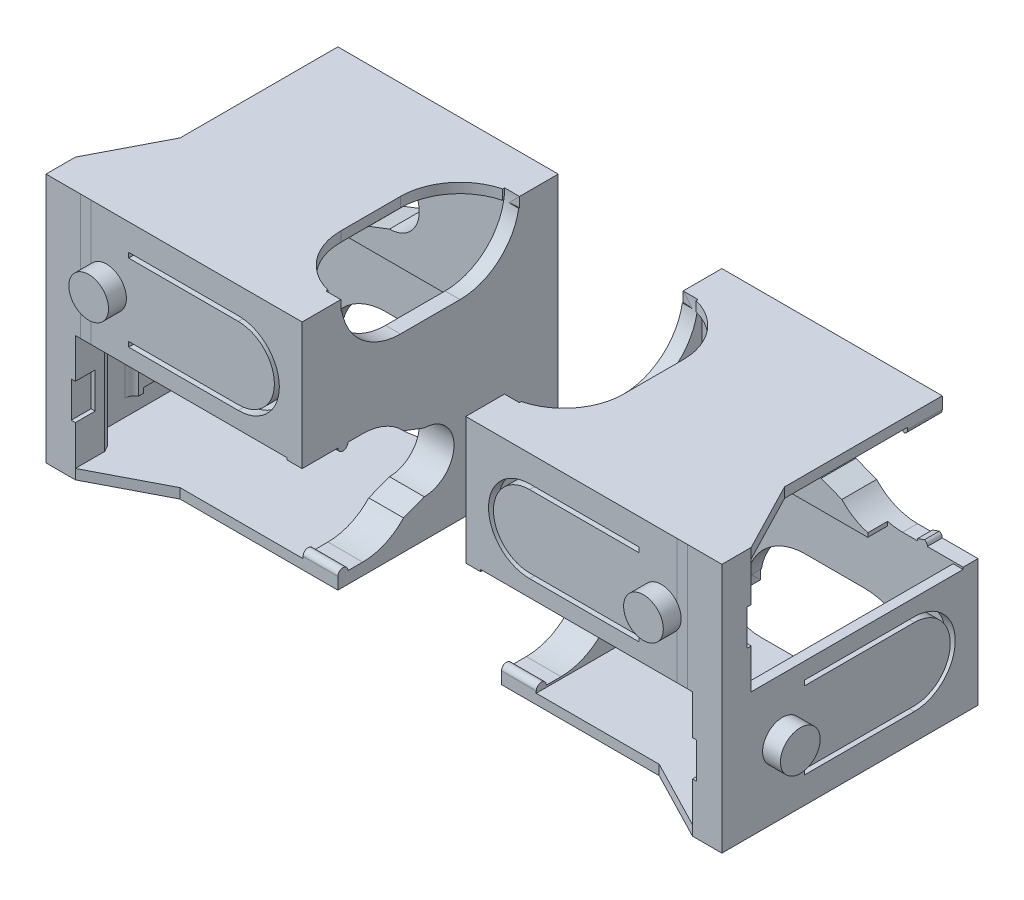
from build123d import *

# Parameters (mm, degrees)
EXTRUDE_1_DEPTH      = 3.5
SKETCH_2_W           = 25.8
SKETCH_2_H           = 12.6
EXTRUDE_2_DEPTH      = 1.5
EXTRUDE_3_DEPTH      = 3.5
SKETCH_4_W           = 24.05
SKETCH_4_H           = 12.4
EXTRUDE_4_DEPTH      = 1.5
EXTRUDE_5_DEPTH      = 18.6
EXTRUDE_6_DEPTH      = 25
EXTRUDE_7_REACH      = 49.494
SKETCH_7_W           = 1.5
SKETCH_7_H           = 12.6
EXTRUDE_8_REACH      = 44.256
SKETCH_9_R           = 2
EXTRUDE_9_DEPTH      = 1.8
SKETCH_10_R          = 2
EXTRUDE_10_DEPTH     = 1.8
SKETCH_11_W          = 2
SKETCH_11_H          = 3.6
CUT_EXTRUDE_1_DEPTH  = 2
SKETCH_12_W          = 2
SKETCH_12_H          = 3.6
CUT_EXTRUDE_2_DEPTH  = 2
EXTRUDE_11_DEPTH     = 24.3
EXTRUDE_12_DEPTH     = 20.8
CUT_EXTRUDE_START    = -12.4
CUT_EXTRUDE_3_DEPTH  = 12.4
CUT_EXTRUDE_START_2  = -12.6
CUT_EXTRUDE_4_DEPTH  = 12.6
EXTRUDE_START        = -12.6
EXTRUDE_15_DEPTH     = 12.6
EXTRUDE_START_2      = -12.4
EXTRUDE_16_DEPTH     = 12.4
EXTRUDE_START_3      = -0.8
EXTRUDE_17_DEPTH     = 0.8
EXTRUDE_START_4      = -1
EXTRUDE_18_DEPTH     = 1
CUT_EXTRUDE_5_DEPTH  = 4
SKETCH_25_W          = 1.5
SKETCH_25_H          = 0.2
EXTRUDE_21_DEPTH     = 3.6
EXTRUDE_22_DEPTH     = 0.2
CUT_EXTRUDE_6_DEPTH  = 4
SKETCH_29_W          = 1.5
SKETCH_29_H          = 0.2
EXTRUDE_24_DEPTH     = 3.6
CUT_EXTRUDE_7_DEPTH  = 1.5
CUT_EXTRUDE_8_DEPTH  = 1
CUT_EXTRUDE_9_DEPTH  = 1.5
CUT_EXTRUDE_10_DEPTH = 1
CUT_EXTRUDE_START_3  = -1.5
CUT_EXTRUDE_11_DEPTH = 1.5
SKETCH_35_W          = 20.566820387
SKETCH_35_H          = 11.6
CUT_EXTRUDE_12_DEPTH = 0.5
FILLET_2_R           = 1
CUT_EXTRUDE_13_DEPTH = 1.5
SKETCH_38_W          = 20.566820387
SKETCH_38_H          = 11.6
CUT_EXTRUDE_14_DEPTH = 0.5
FILLET_3_R           = 1


with BuildPart() as part:
    # ｽｹｯﾁ1 → ﾎﾞｽ - 押し出し1 (new body)
    with BuildSketch(Plane(origin=(0, 0, -3.388895834), x_dir=(-1, 0, 0), z_dir=(0, 0, -1))):
        with BuildLine():
            Line((-21.742324867, 16.721375858), (-23.828932106, 15.921375858))
            ThreePointArc((-23.828932106, 15.921375858), (-25.697330435, 14.591073722), (-27.942324867, 14.121375858))
            Line((-27.942324867, 14.121375858), (-29.421312595, 14.121375858))
            ThreePointArc((-29.421312595, 14.121375858), (-29.432926589, 14.229649335), (-29.467240137, 14.332996378))
            ThreePointArc((-29.467240137, 14.332996378), (-29.817026044, 14.444492735), (-30.158754705, 14.578668519))
            ThreePointArc((-30.158754705, 14.578668519), (-30.365678571, 14.390415174), (-30.442324867, 14.121375858))
            Line((-30.442324867, 14.121375858), (-30.442324867, 13.921375858))
            Line((-30.442324867, 13.921375858), (-27.942324867, 13.921375858))
            Line((-27.942324867, 13.921375858), (-9.742324867, 13.921375858))
            Line((-9.742324867, 13.921375858), (-8.242324867, 13.921375858))
            Line((-8.242324867, 13.921375858), (-8.242324867, 25.521375858))
            Line((-8.242324867, 25.521375858), (-8.242324867, 26.321375858))
            Line((-8.242324867, 26.321375858), (-27.942324867, 26.321375858))
            Line((-27.942324867, 26.321375858), (-30.442324867, 26.321375858))
            Line((-30.442324867, 26.321375858), (-30.442324867, 25.321375858))
            ThreePointArc((-30.442324867, 25.321375858), (-30.365678571, 25.052336541), (-30.158754705, 24.864083196))
            ThreePointArc((-30.158754705, 24.864083196), (-29.817026044, 24.998258981), (-29.467240137, 25.109755337))
            ThreePointArc((-29.467240137, 25.109755337), (-29.432926589, 25.21310238), (-29.421312595, 25.321375858))
            Line((-29.421312595, 25.321375858), (-27.942324867, 25.321375858))
            ThreePointArc((-27.942324867, 25.321375858), (-25.697330435, 24.851677993), (-23.828932106, 23.521375858))
            Line((-23.828932106, 23.521375858), (-21.742324867, 22.721375858))
            ThreePointArc((-21.742324867, 22.721375858), (-18.742324867, 19.721375858), (-21.742324867, 16.721375858))
        make_face()
    extrude(amount=-EXTRUDE_1_DEPTH)

    # ｽｹｯﾁ2 → ﾎﾞｽ - 押し出し2 (add)
    with BuildSketch(Plane(origin=(0, 0, -3.388895834), x_dir=(-1, 0, 0), z_dir=(0, 0, -1))):
        with Locations((-21.142324867, 7.621375858)):
            Rectangle(SKETCH_2_W, SKETCH_2_H)
    extrude(amount=-EXTRUDE_2_DEPTH)

    # ｽｹｯﾁ3 → ﾎﾞｽ - 押し出し3 (add)
    with BuildSketch(Plane.ZY.offset(-8.242324867)):
        with BuildLine():
            Line((12.197711406, 11.921375858), (10.111104166, 11.121375858))
            ThreePointArc((10.111104166, 11.121375858), (7.111104166, 8.121375858), (10.111104166, 5.121375858))
            Line((10.111104166, 5.121375858), (12.197711406, 4.321375858))
            ThreePointArc((12.197711406, 4.321375858), (14.066109734, 2.991073722), (16.311104166, 2.521375858))
            Line((16.311104166, 2.521375858), (17.790091895, 2.521375858))
            ThreePointArc((17.790091895, 2.521375858), (18.300598031, 3.031881993), (18.811104166, 2.521375858))
            Line((18.811104166, 2.521375858), (18.811104166, 1.521375858))
            Line((18.811104166, 1.521375858), (16.311104166, 1.521375858))
            Line((16.311104166, 1.521375858), (-3.388895834, 1.521375858))
            Line((-3.388895834, 1.521375858), (-3.388895834, 2.321375858))
            Line((-3.388895834, 2.321375858), (-3.388895834, 13.921375858))
            Line((-3.388895834, 13.921375858), (-1.888895834, 13.921375858))
            Line((-1.888895834, 13.921375858), (16.311104166, 13.921375858))
            Line((16.311104166, 13.921375858), (18.811104166, 13.921375858))
            Line((18.811104166, 13.921375858), (18.811104166, 13.721375858))
            ThreePointArc((18.811104166, 13.721375858), (18.300598031, 13.210869722), (17.790091895, 13.721375858))
            Line((17.790091895, 13.721375858), (16.311104166, 13.721375858))
            ThreePointArc((16.311104166, 13.721375858), (14.066109734, 13.251677993), (12.197711406, 11.921375858))
        make_face()
    extrude(amount=-EXTRUDE_3_DEPTH)

    # ｽｹｯﾁ4 → ﾎﾞｽ - 押し出し4 (add)
    with BuildSketch(Plane.ZY.offset(-8.242324867)):
        with Locations((10.386104166, 20.121375858)):
            Rectangle(SKETCH_4_W, SKETCH_4_H)
    extrude(amount=-EXTRUDE_4_DEPTH)

    # ｽｹｯﾁ5 → ﾎﾞｽ - 押し出し5 (add)
    with BuildSketch(Plane.XY.offset(-1.888895834)):
        Polygon((34.042324867, 13.921375858), (34.042324867, 1.321375858), (32.542324867, 1.321375858), (32.542324867, 2.321375858), (32.542324867, 13.921375858), align=None)
    extrude(amount=EXTRUDE_5_DEPTH)


with BuildPart() as body_2:
    # ｽｹｯﾁ6 → ﾎﾞｽ - 押し出し6 (new body)
    with BuildSketch(Plane.XZ.offset(-1.321375858)):
        Polygon((34.042324867, 17.880360406), (34.042324867, 18.947437856), (34.042324867, 22.410508876), (30.575188816, 22.410508876), (29.512560459, 22.409262271), (29.777435822, 21.911104166), (31.084359298, 19.453138597), (33.542324867, 18.146215122), align=None)
    extrude(amount=-EXTRUDE_6_DEPTH)

    # ｽｹｯﾁ7 → ﾎﾞｽ - 押し出し7 (add, up to next)
    with BuildSketch(Plane.XY.offset(16.711104166), mode=Mode.PRIVATE) as extrude_7_sk1:
        with Locations((33.292324867, 7.621375858)):
            Rectangle(SKETCH_7_W, SKETCH_7_H)
    extrude_7_tool1 = extrude(extrude_7_sk1.sketch, amount=EXTRUDE_7_REACH, mode=Mode.PRIVATE) - body_2.part

    add(part.part)  # ﾎﾞｽ - 押し出し7 merges part
    add(extrude_7_tool1.solids().sort_by_distance((33.292325, 7.621376, 16.711104))[0])

    # ﾎﾞｽ - 押し出し8: up to this plane
    extrude_8_end = Plane(origin=(29.777435822, 26.321375858, 21.911104166), z_dir=(-0.882947592858927, 0, -0.46947156278589064))
    # ｽｹｯﾁ8 → ﾎﾞｽ - 押し出し8 (add, up to the surface)
    with BuildSketch(Plane(origin=(9.742324867, 0, 0), x_dir=(0, 0, -1), z_dir=(1, 0, 0)), mode=Mode.PRIVATE) as extrude_8_sk1:
        Polygon((-22.411104166, 13.921375858), (-22.411104166, 26.321375858), (-20.911104166, 26.321375858), (-20.911104166, 25.521375858), (-20.911104166, 13.921375858), align=None)
    extrude_8_tool1 = split(extrude(extrude_8_sk1.sketch, amount=EXTRUDE_8_REACH, mode=Mode.PRIVATE), bisect_by=extrude_8_end, keep=Keep.BOTH, mode=Mode.PRIVATE)
    add(extrude_8_tool1.solids().sort_by_distance((9.742325, 20.121376, 21.661104))[0])

    # ｽｹｯﾁ9 → ﾎﾞｽ - 押し出し9 (add)
    with BuildSketch(Plane(origin=(34.042324867, 0, 0), x_dir=(0, 0, -1), z_dir=(1, 0, 0))):
        with Locations((-16.311104166, 8.121375858)):
            Circle(SKETCH_9_R)
    extrude(amount=EXTRUDE_9_DEPTH)

    # ｽｹｯﾁ10 → ﾎﾞｽ - 押し出し10 (add)
    with BuildSketch(Plane.XY.offset(22.411104166)):
        with Locations(Location((27.942324867, 19.721375858, 0), (0, 0, 38.313703041))):
            Circle(SKETCH_10_R)
    extrude(amount=EXTRUDE_10_DEPTH)

    # ｽｹｯﾁ11 → ｶｯﾄ - 押し出し1 (cut)
    with BuildSketch(Plane(origin=(34.042324867, 0, 0), x_dir=(0, 0, -1), z_dir=(1, 0, 0))):
        with Locations((-18.880360406, 19.721375858)):
            Rectangle(SKETCH_11_W, SKETCH_11_H)
    extrude(amount=-CUT_EXTRUDE_1_DEPTH, mode=Mode.SUBTRACT)

    # ｽｹｯﾁ12 → ｶｯﾄ - 押し出し2 (cut)
    with BuildSketch(Plane(origin=(-0.026248422, 0, 22.37460928), x_dir=(0.9999993118786262, 0, 0.0011731335278723988), z_dir=(-0.0011731335278723988, 0, 0.9999993118786262))):
        with Locations((30.522496194, 8.121375858)):
            Rectangle(SKETCH_12_W, SKETCH_12_H)
    extrude(amount=-CUT_EXTRUDE_2_DEPTH, mode=Mode.SUBTRACT)

    # ｽｹｯﾁ13 → ﾎﾞｽ - 押し出し11 (add)
    with BuildSketch(Plane.ZY.offset(-32.542324867)):
        Polygon((18.677924553, 1.321375858), (-1.888895834, 1.321375858), (-1.888895834, 2.321375858), (16.711104166, 2.321375858), (18.811104166, 2.321375858), (18.811104166, 1.521375858), (18.811104166, 1.321375858), align=None)
    extrude(amount=EXTRUDE_11_DEPTH)

    # ｽｹｯﾁ14 → ﾎﾞｽ - 押し出し12 (add)
    with BuildSketch(Plane(origin=(0, 0, 20.911104166), x_dir=(-1, 0, 0), z_dir=(0, 0, -1))):
        Polygon((-30.442324867, 26.321375858), (-30.442324867, 25.521375858), (-28.342324867, 25.521375858), (-9.742324867, 25.521375858), (-9.742324867, 26.321375858), (-30.309145254, 26.321375858), align=None)
    extrude(amount=EXTRUDE_12_DEPTH)

    # ｽｹｯﾁ15 → ｶｯﾄ - 押し出し3 (cut)
    with BuildSketch(Plane(origin=(0, 26.321375858, 0), x_dir=(1, 0, 0), z_dir=(0, 1, 0)).offset(CUT_EXTRUDE_START)):
        Polygon((31.084359298, -19.453138597), (34.042324867, -19.453138597), (34.042324867, -17.880360406), align=None)
    extrude(amount=CUT_EXTRUDE_3_DEPTH, mode=Mode.SUBTRACT)

    # ｽｹｯﾁ16 → ｶｯﾄ - 押し出し4 (cut)
    with BuildSketch(Plane.XZ.offset(-1.321375858).offset(CUT_EXTRUDE_START_2)):
        Polygon((29.512560459, 22.409262271), (31.084359298, 19.453138597), (31.084359298, 22.410508876), (30.575188816, 22.410508876), align=None)
    extrude(amount=CUT_EXTRUDE_4_DEPTH, mode=Mode.SUBTRACT)

    # ｽｹｯﾁ18 → ﾎﾞｽ - 押し出し15 (add)
    with BuildSketch(Plane.XZ.offset(-1.321375858).offset(EXTRUDE_START)):
        Polygon((31.42573506, 18.811104166), (32.291850444, 18.811104166), (31.084359298, 19.453138597), align=None)
    extrude(amount=EXTRUDE_15_DEPTH)

    # ｽｹｯﾁ19 → ﾎﾞｽ - 押し出し16 (add)
    with BuildSketch(Plane(origin=(0, 26.321375858, 0), x_dir=(1, 0, 0), z_dir=(0, 1, 0)).offset(EXTRUDE_START_2)):
        Polygon((30.442324867, -20.660629744), (31.084359298, -19.453138597), (30.442324867, -19.79451436), align=None)
    extrude(amount=EXTRUDE_16_DEPTH)

    # ｽｹｯﾁ20 → ﾎﾞｽ - 押し出し17 (add)
    with BuildSketch(Plane(origin=(0, 26.321375858, 0), x_dir=(1, 0, 0), z_dir=(0, 1, 0)).offset(EXTRUDE_START_3)):
        Polygon((34.042324867, -19.453138597), (30.442324867, -12.498495542), (30.442324867, -19.79451436), (31.084359298, -19.453138597), align=None)
    extrude(amount=EXTRUDE_17_DEPTH)

    # ｽｹｯﾁ21 → ﾎﾞｽ - 押し出し18 (add)
    with BuildSketch(Plane.XZ.offset(-1.321375858).offset(EXTRUDE_START_4)):
        Polygon((31.084359298, 22.411104166), (24.129716242, 18.811104166), (31.42573506, 18.811104166), (31.084359298, 19.453138597), align=None)
    extrude(amount=EXTRUDE_18_DEPTH)

    # ｽｹｯﾁ24 → ｶｯﾄ - 押し出し5 (cut)
    with BuildSketch(Plane(origin=(30.442324867, 0, 0), x_dir=(0, 0, -1), z_dir=(1, 0, 0))):
        Polygon((1.888895834, 13.921375858), (1.888895834, 14.121375858), (1.888895834, 14.578668519), (-0.111104166, 14.578668519), (-0.111104166, 14.121375858), (-0.111104166, 13.921375858), align=None)
    extrude(amount=-CUT_EXTRUDE_5_DEPTH, mode=Mode.SUBTRACT)

    # ｽｹｯﾁ25 → ﾎﾞｽ - 押し出し21 (add)
    with BuildSketch(Plane(origin=(30.442324867, 0, 0), x_dir=(0, 0, -1), z_dir=(1, 0, 0))):
        with Locations((2.638895834, 14.021375858)):
            Rectangle(SKETCH_25_W, SKETCH_25_H)
    extrude(amount=EXTRUDE_21_DEPTH)

    # ｽｹｯﾁ26 → ﾎﾞｽ - 押し出し22 (add)
    with BuildSketch(Plane(origin=(0, 26.321375858, 0), x_dir=(1, 0, 0), z_dir=(0, 1, 0))):
        Polygon((34.042324867, -19.453138597), (30.442324867, -12.498495542), (30.442324867, 3.388895834), (8.242324867, 3.388895834), (8.242324867, -22.411104166), (29.511581106, -22.411104166), (29.512560459, -22.409262271), (30.575188816, -22.410508876), (34.042324867, -22.410508876), align=None)
    extrude(amount=EXTRUDE_22_DEPTH)

    # ｽｹｯﾁ28 → ｶｯﾄ - 押し出し6 (cut)
    with BuildSketch(Plane.XY.offset(18.811104166)):
        Polygon((9.742324867, 13.921375858), (9.742324867, 13.210869722), (11.742324867, 13.210869722), (11.742324867, 13.721375858), (11.742324867, 13.921375858), align=None)
    extrude(amount=-CUT_EXTRUDE_6_DEPTH, mode=Mode.SUBTRACT)

    # ｽｹｯﾁ29 → ﾎﾞｽ - 押し出し24 (add)
    with BuildSketch(Plane.XY.offset(18.811104166)):
        with Locations((8.992324867, 13.821375858)):
            Rectangle(SKETCH_29_W, SKETCH_29_H)
    extrude(amount=EXTRUDE_24_DEPTH)

    # ｽｹｯﾁ30 → ｶｯﾄ - 押し出し7 (cut)
    with BuildSketch(Plane.ZY.offset(-8.242324867)):
        with BuildLine():
            Line((6.511104166, 20.521375858), (12.511104166, 20.521375858))
            ThreePointArc((12.511104166, 20.521375858), (16.753744854, 22.27873517), (18.511104166, 26.521375858))
            Line((18.511104166, 26.521375858), (0.511104166, 26.521375858))
            ThreePointArc((0.511104166, 26.521375858), (2.268463479, 22.27873517), (6.511104166, 20.521375858))
        make_face()
    extrude(amount=-CUT_EXTRUDE_7_DEPTH, mode=Mode.SUBTRACT)

    # ｽｹｯﾁ31 → ｶｯﾄ - 押し出し8 (cut)
    with BuildSketch(Plane(origin=(0, 26.521375858, 0), x_dir=(1, 0, 0), z_dir=(0, 1, 0))):
        with BuildLine():
            Line((2.242324867, -12.511104166), (2.242324867, -6.511104166))
            ThreePointArc((2.242324867, -6.511104166), (8.242324867, -0.511104166), (14.242324867, -6.511104166))
            Line((14.242324867, -6.511104166), (14.242324867, -12.511104166))
            ThreePointArc((14.242324867, -12.511104166), (8.242324867, -18.511104166), (2.242324867, -12.511104166))
        make_face()
    extrude(amount=-CUT_EXTRUDE_8_DEPTH, mode=Mode.SUBTRACT)

    # ｽｹｯﾁ32 → ｶｯﾄ - 押し出し9 (cut)
    with BuildSketch(Plane(origin=(0, 0, -3.388895834), x_dir=(-1, 0, 0), z_dir=(0, 0, -1))):
        with BuildLine():
            Line((-24.142324867, 7.321375858), (-18.142324867, 7.321375858))
            ThreePointArc((-18.142324867, 7.321375858), (-12.142324867, 1.321375858), (-18.142324867, -4.678624142))
            Line((-18.142324867, -4.678624142), (-24.142324867, -4.678624142))
            ThreePointArc((-24.142324867, -4.678624142), (-30.142324867, 1.321375858), (-24.142324867, 7.321375858))
        make_face()
    extrude(amount=-CUT_EXTRUDE_9_DEPTH, mode=Mode.SUBTRACT)

    # ｽｹｯﾁ33 → ｶｯﾄ - 押し出し10 (cut)
    with BuildSketch(Plane.XZ.offset(-1.321375858)):
        with BuildLine():
            Line((18.142324867, 2.611104166), (24.142324867, 2.611104166))
            ThreePointArc((24.142324867, 2.611104166), (30.142324867, -3.388895834), (24.142324867, -9.388895834))
            Line((24.142324867, -9.388895834), (18.142324867, -9.388895834))
            ThreePointArc((18.142324867, -9.388895834), (12.142324867, -3.388895834), (18.142324867, 2.611104166))
        make_face()
    extrude(amount=-CUT_EXTRUDE_10_DEPTH, mode=Mode.SUBTRACT)

    # ｽｹｯﾁ34 → ｶｯﾄ - 押し出し11 (cut)
    with BuildSketch(Plane(origin=(0, 0, 20.911104166), x_dir=(-1, 0, 0), z_dir=(0, 0, -1)).offset(CUT_EXTRUDE_START_3)):
        with BuildLine():
            Line((-25.714551979, 23.356587125), (-14.671066064, 23.356587125))
            ThreePointArc((-14.671066064, 23.356587125), (-11.035854796, 19.721375858), (-14.671066064, 16.08616459))
            Line((-14.671066064, 16.08616459), (-25.714551979, 16.08616459))
            Line((-25.714551979, 16.08616459), (-25.714551979, 15.58616459))
            Line((-25.714551979, 15.58616459), (-14.671066064, 15.58616459))
            ThreePointArc((-14.671066064, 15.58616459), (-10.535854796, 19.721375858), (-14.671066064, 23.856587125))
            Line((-14.671066064, 23.856587125), (-25.714551979, 23.856587125))
            Line((-25.714551979, 23.856587125), (-25.714551979, 23.356587125))
        make_face()
    extrude(amount=CUT_EXTRUDE_11_DEPTH, mode=Mode.SUBTRACT)

    # ｽｹｯﾁ35 → ｶｯﾄ - 押し出し12 (cut)
    with BuildSketch(Plane(origin=(0, 0, 20.911104166), x_dir=(-1, 0, 0), z_dir=(0, 0, -1))):
        with Locations((-20.025735061, 19.721375858)):
            Rectangle(SKETCH_35_W, SKETCH_35_H)
        with BuildLine():
            Line((-14.671066064, 23.856587125), (-25.714551979, 23.856587125))
            Line((-25.714551979, 23.856587125), (-26.214551979, 23.856587125))
            Line((-26.214551979, 23.856587125), (-26.214551979, 15.58616459))
            Line((-26.214551979, 15.58616459), (-25.714551979, 15.58616459))
            Line((-25.714551979, 15.58616459), (-14.671066064, 15.58616459))
            ThreePointArc((-14.671066064, 15.58616459), (-10.535854796, 19.721375858), (-14.671066064, 23.856587125))
        make_face(mode=Mode.SUBTRACT)
    extrude(amount=-CUT_EXTRUDE_12_DEPTH, mode=Mode.SUBTRACT)

    # ﾌｨﾚｯﾄ2
    # the kernel refuses this fillet: 1 mm, written as the material it adds along each edge
    with BuildSketch(Plane(origin=(26.214551979, 23.856587125, 21.411104166), x_dir=(0, 0, -1), z_dir=(0, -1, 0))) as fillet_2_piece_1:
        with BuildLine():
            CenterArc((1, 0.866025404), FILLET_2_R, 180, 60)
            Line((0, 0.866025404), (-0.02, 0.866025404))
            Line((-0.02, 0.866025404), (-0.02, 0))
            Line((-0.02, 0), (0, -0.02))
            ThreePointArc((0, -0.02), (0.25, -0.02), (0.49, -0.017320508))
            Line((0.49, -0.017320508), (0.5, 0))
        make_face()
    extrude(amount=8.270422535)

    # ｽｹｯﾁ37 → ｶｯﾄ - 押し出し13 (cut)
    with BuildSketch(Plane.ZY.offset(-32.542324867)):
        with BuildLine():
            Line((14.083331279, 4.48616459), (3.039845364, 4.48616459))
            ThreePointArc((3.039845364, 4.48616459), (-0.595365904, 8.121375858), (3.039845364, 11.756587125))
            Line((3.039845364, 11.756587125), (14.083331279, 11.756587125))
            Line((14.083331279, 11.756587125), (14.083331279, 12.256587125))
            Line((14.083331279, 12.256587125), (3.039845364, 12.256587125))
            ThreePointArc((3.039845364, 12.256587125), (-1.095365904, 8.121375858), (3.039845364, 3.98616459))
            Line((3.039845364, 3.98616459), (14.083331279, 3.98616459))
            Line((14.083331279, 3.98616459), (14.083331279, 4.48616459))
        make_face()
    extrude(amount=-CUT_EXTRUDE_13_DEPTH, mode=Mode.SUBTRACT)

    # ｽｹｯﾁ38 → ｶｯﾄ - 押し出し14 (cut)
    with BuildSketch(Plane.ZY.offset(-32.542324867)):
        with Locations((8.39451436, 8.121375858)):
            Rectangle(SKETCH_38_W, SKETCH_38_H)
        with BuildLine():
            Line((14.083331279, 12.256587125), (3.039845364, 12.256587125))
            ThreePointArc((3.039845364, 12.256587125), (-1.095365904, 8.121375858), (3.039845364, 3.98616459))
            Line((3.039845364, 3.98616459), (14.083331279, 3.98616459))
            Line((14.083331279, 3.98616459), (14.583331279, 3.98616459))
            Line((14.583331279, 3.98616459), (14.583331279, 12.256587125))
            Line((14.583331279, 12.256587125), (14.083331279, 12.256587125))
        make_face(mode=Mode.SUBTRACT)
    extrude(amount=-CUT_EXTRUDE_14_DEPTH, mode=Mode.SUBTRACT)

    # ﾌｨﾚｯﾄ3
    # the kernel refuses this fillet: 1 mm, written as the material it adds along each edge
    with BuildSketch(Plane(origin=(33.042324867, 3.98616459, 14.583331279), x_dir=(0, 0, 1), z_dir=(0, 1, 0))) as fillet_3_piece_1:
        with BuildLine():
            CenterArc((0.866025404, -1), FILLET_3_R, 90, 60)
            Line((0, -0.5), (-0.017320508, -0.49))
            ThreePointArc((-0.017320508, -0.49), (-0.02, -0.25), (-0.02, 0))
            Line((-0.02, 0), (0, 0.02))
            Line((0, 0.02), (0.866025404, 0.02))
            Line((0.866025404, 0.02), (0.866025404, 0))
        make_face()
    extrude(amount=8.270422535)


with BuildPart() as body_2_2:
    # ﾐﾗｰ2: mirrored copy
    add(body_2.part.mirror(Plane(origin=(0, 0, 0), x_dir=(0, 0, 1), z_dir=(1, 0, 0))))


solid = Compound([body_2.part, body_2_2.part])
